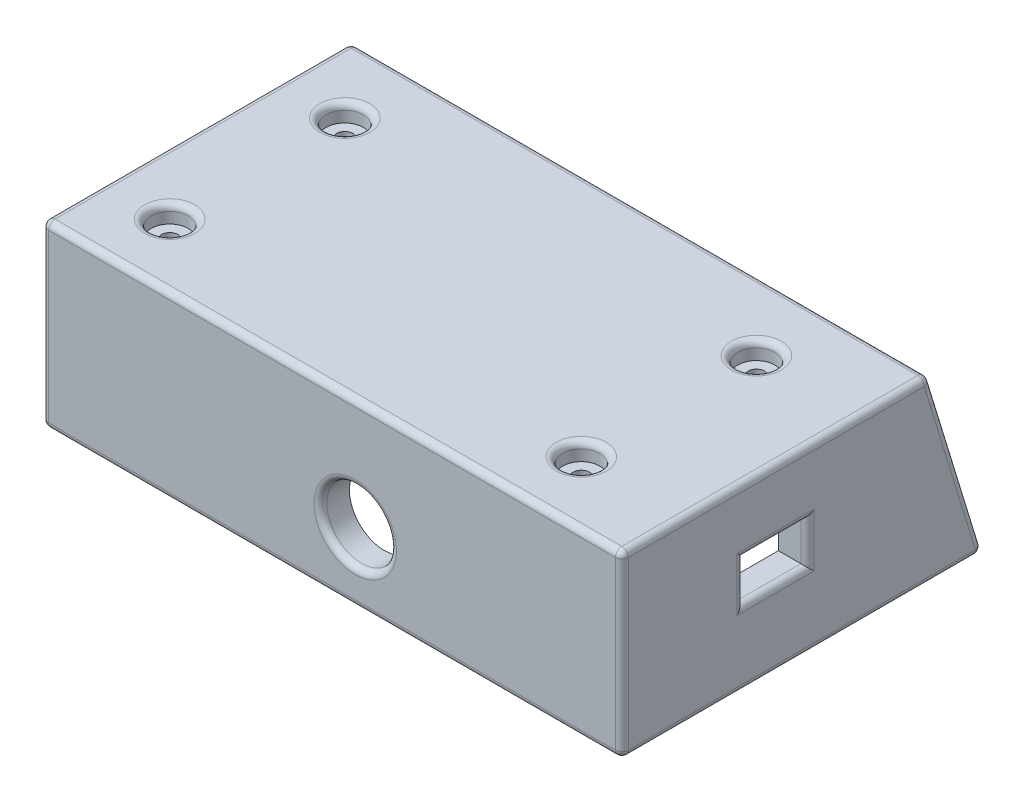
from build123d import *

# Parameters (mm, degrees)
SKETCH_1_W                      = 10
SKETCH_1_H                      = 5.3
EXTRUDE_1_DEPTH                 = 2.8
CUT_EXTRUDE_1_DEPTH             = 2.5
SKETCH_4_R                      = 0.13999999999999993
SKETCH_4_R_2                    = 0.13999999999999987
CUT_EXTRUDE_2_DEPTH             = 0.3
CUT_EXTRUDE_3_REACH             = 13.659
CUT_EXTRUDE_4_REACH             = 13.659
SKETCH_7_W                      = 3
SKETCH_7_H                      = 0.5
CUT_EXTRUDE_4_DIRECTION_2_DEPTH = 10
SKETCH_8_W                      = 10
SKETCH_8_H                      = 5.3
SKETCH_8_R                      = 0.3200000000000004
SKETCH_8_R_2                    = 0.3200000000000005
SKETCH_8_R_3                    = 0.32
EXTRUDE_4_DEPTH                 = 0.3
EXTRUDE_5_DEPTH                 = 10
CUT_EXTRUDE_5_REACH             = 13.517
SKETCH_10_W                     = 3.000000000000001
SKETCH_10_H                     = 0.5000000000000002
CUT_EXTRUDE_6_REACH             = 14.193
SKETCH_11_R                     = 0.6000000000000002
SCALE_1_SCALE                   = 10
FILLET_1_R                      = 1.11
FILLET_2_R                      = 1.11
FILLET_3_R                      = 1.11
FILLET_4_R                      = 1.11
FILLET_5_R                      = 1.11


with BuildPart() as part:
    # 草圖1 → 填料-伸長1 (new body)
    with BuildSketch(Plane(origin=(0, 0, 0), x_dir=(1, 0, 0), z_dir=(0, 1, 0))):
        with Locations((5, 2.65)):
            Rectangle(SKETCH_1_W, SKETCH_1_H)
    extrude(amount=EXTRUDE_1_DEPTH)

    # 草圖3 → 除料-伸長1 (cut)
    with BuildSketch(Plane.XZ):
        Polygon((9.5, -4.799999999999999), (0.5000000000000004, -4.8), (0.5000000000000004, -0.5000000000000011), (9.5, -0.5), align=None)
    extrude(amount=-CUT_EXTRUDE_1_DEPTH, mode=Mode.SUBTRACT)

    # 草圖4 → 除料-伸長2 (cut)
    with BuildSketch(Plane(origin=(0, 2.8, 0), x_dir=(1, 0, 0), z_dir=(0, 1, 0))):
        with Locations(Location((1.1, 1.1, 0), (0, 0, 270))):
            Circle(SKETCH_4_R)
        with Locations(Location((1.1, 4.12, 0), (0, 0, 270))):
            Circle(SKETCH_4_R)
        with Locations(Location((8.2, 1.1, 0), (0, 0, 270))):
            Circle(SKETCH_4_R_2)
        with Locations(Location((8.2, 4.12, 0), (0, 0, 270))):
            Circle(SKETCH_4_R)
    extrude(amount=-CUT_EXTRUDE_2_DEPTH, mode=Mode.SUBTRACT)

    # 草圖5 → 除料-伸長3 (cut, up to next)
    with BuildSketch(Plane(origin=(10, 0, 0), x_dir=(0, 0, -1), z_dir=(1, 0, 0)), mode=Mode.PRIVATE) as cut_extrude_3_sk1:
        Polygon((3.199968847141929, 1.9968818566740154), (2.100259628985645, 1.9968818566740154), (2.100259628985645, 1.296236122516535), (3.199968847141929, 1.2962361225165353), align=None)
    cut_extrude_3_tool1 = extrude(cut_extrude_3_sk1.sketch, amount=-CUT_EXTRUDE_3_REACH, mode=Mode.PRIVATE) & part.part
    add(cut_extrude_3_tool1.solids().sort_by_distance((10, 1.646559, -2.650114))[0], mode=Mode.SUBTRACT)

    # 草圖7 → 除料-伸長4 (cut, up to next)
    with BuildSketch(Plane(origin=(0, 0, -5.3), x_dir=(-1, 0, 0), z_dir=(0, 0, -1)), mode=Mode.PRIVATE) as cut_extrude_4_sk1:
        with Locations((-6.5, 0.55)):
            Rectangle(SKETCH_7_W, SKETCH_7_H)
    cut_extrude_4_tool1 = extrude(cut_extrude_4_sk1.sketch, amount=-CUT_EXTRUDE_4_REACH, mode=Mode.PRIVATE) & part.part
    add(cut_extrude_4_tool1.solids().sort_by_distance((6.5, 0.55, -5.3))[0], mode=Mode.SUBTRACT)

    # 草圖7 → 除料-伸長4 direction 2 (cut)
    with BuildSketch(Plane(origin=(0, 0, -5.3), x_dir=(-1, 0, 0), z_dir=(0, 0, -1))):
        with Locations((-6.5, 0.55)):
            Rectangle(SKETCH_7_W, SKETCH_7_H)
    extrude(amount=CUT_EXTRUDE_4_DIRECTION_2_DEPTH, mode=Mode.SUBTRACT)

    # 草圖8 → 填料-伸長4 (add)
    with BuildSketch(Plane(origin=(0, 2.8, 0), x_dir=(1, 0, 0), z_dir=(0, 1, 0))):
        with Locations((5, 2.65)):
            Rectangle(SKETCH_8_W, SKETCH_8_H)
        with Locations(Location((8.2, 1.1, 0), (0, 0, 270))):
            Circle(SKETCH_8_R, mode=Mode.SUBTRACT)
        with Locations(Location((8.2, 4.12, 0), (0, 0, 270))):
            Circle(SKETCH_8_R_2, mode=Mode.SUBTRACT)
        with Locations(Location((1.1000000000000003, 4.12, 0), (0, 0, 270))):
            Circle(SKETCH_8_R_3, mode=Mode.SUBTRACT)
        with Locations(Location((1.1000000000000003, 1.1, 0), (0, 0, 270))):
            Circle(SKETCH_8_R, mode=Mode.SUBTRACT)
    extrude(amount=EXTRUDE_4_DEPTH)

    # 草圖9 → 填料-伸長5 (add)
    with BuildSketch(Plane.ZY):
        Polygon((-5.3, 0), (-6.248856782761436, 0), (-5.3, 3.1), align=None)
    extrude(amount=-EXTRUDE_5_DEPTH)

    # 草圖10 → 除料-伸長5 (cut, up to next)
    with BuildSketch(Plane.XY.offset(-4.8), mode=Mode.PRIVATE) as cut_extrude_5_sk1:
        with Locations((6.5, 0.5500000000000002)):
            Rectangle(SKETCH_10_W, SKETCH_10_H)
    cut_extrude_5_tool1 = extrude(cut_extrude_5_sk1.sketch, amount=-CUT_EXTRUDE_5_REACH, mode=Mode.PRIVATE) & part.part
    add(cut_extrude_5_tool1.solids().sort_by_distance((6.5, 0.55, -4.8))[0], mode=Mode.SUBTRACT)

    # 草圖11 → 除料-伸長6 (cut, up to next)
    with BuildSketch(Plane.XY, mode=Mode.PRIVATE) as cut_extrude_6_sk1:
        with Locations((5.4, 1.2)):
            Circle(SKETCH_11_R)
    cut_extrude_6_tool1 = extrude(cut_extrude_6_sk1.sketch, amount=-CUT_EXTRUDE_6_REACH, mode=Mode.PRIVATE) & part.part
    add(cut_extrude_6_tool1.solids().sort_by_distance((5.4, 1.2, 0))[0], mode=Mode.SUBTRACT)


with BuildPart() as part_1:
    # 縮放比例1: scaled about (4.939483412, 1.840089484, -3.152251455)
    add(part.part.scale(SCALE_1_SCALE).moved(Location((-44.455350708000005, -16.560805356, 28.370263095))))

    # 圓角1
    fillet_1_edges = [part_1.edges().sort_by_distance(p)[0] for p in [
        (-44.455350708000005, -1.0608053559999977, -29.374020818807182),
        (-44.455350708000005, -16.560805356, -2.874020818807182),
        (-44.455350708000005, 14.439194644, 1.8702630949999985),
        (-44.455350708000005, -1.0608053560000013, 28.370263095),
    ]]
    fillet(fillet_1_edges, radius=FILLET_1_R)

    # 圓角2
    fillet_2_edges = [part_1.edges().sort_by_distance(p)[0] for p in [
        (55.544649291999995, -1.0608053559999977, -29.374020818807182),
        (55.544649291999995, -0.09521546004724613, -3.6294253764192916),
        (55.544649291999995, 3.4080132107401546, 1.8691207143621291),
        (55.544649291999995, -0.09521546004724613, 7.367666805143546),
        (55.544649291999995, -3.598444130834647, 1.8691207143621256),
        (55.544649291999995, -16.560805356, -2.874020818807182),
        (55.544649291999995, -1.0608053560000013, 28.370263095),
        (55.544649291999995, 14.439194644, 1.8702630949999985),
    ]]
    fillet(fillet_2_edges, radius=FILLET_2_R)

    # 圓角3
    # the kernel refuses this fillet: 1.11 mm, written as the material it takes off along each edge
    with BuildSketch(Plane(origin=(-43.345350708000005, 13.329194644000001, 27.260263095), x_dir=(0, 1, 0), z_dir=(0, 0, 1))) as fillet_3_piece_1_section:
        Polygon((0, 0), (FILLET_3_R, 0), (FILLET_3_R, FILLET_3_R), (0, FILLET_3_R), align=None)
    fillet_3_piece_1 = extrude(amount=FILLET_3_R, mode=Mode.PRIVATE)
    fillet_3_piece_1 = fillet_3_piece_1 - Plane(origin=(-43.345350708000005, 13.329194644000001, 27.260263095), x_dir=(0.7071067811865475, -0.7071067811865475, 0), z_dir=(0, 0, 1)) * Sphere(FILLET_3_R, mode=Mode.PRIVATE)
    add(fillet_3_piece_1, mode=Mode.SUBTRACT)
    with BuildSketch(Plane(origin=(-43.345350708000005, -15.450805356, 27.260263095), x_dir=(0, -1, 0), z_dir=(0, 0, 1))) as fillet_3_piece_2_section:
        Polygon((0, 0), (FILLET_3_R, 0), (FILLET_3_R, -FILLET_3_R), (0, -FILLET_3_R), align=None)
    fillet_3_piece_2 = extrude(amount=FILLET_3_R, mode=Mode.PRIVATE)
    fillet_3_piece_2 = fillet_3_piece_2 - Plane(origin=(-43.345350708000005, -15.450805356, 27.260263095), x_dir=(0.7071067811865475, 0.7071067811865475, 0), z_dir=(0, 0, 1)) * Sphere(FILLET_3_R, mode=Mode.PRIVATE)
    add(fillet_3_piece_2, mode=Mode.SUBTRACT)
    with BuildSketch(Plane(origin=(54.434649291999996, 13.329194644000001, 27.260263095), x_dir=(0, 1, 0), z_dir=(0, 0, 1))) as fillet_3_piece_3_section:
        Polygon((0, 0), (FILLET_3_R, 0), (FILLET_3_R, -FILLET_3_R), (0, -FILLET_3_R), align=None)
    fillet_3_piece_3 = extrude(amount=FILLET_3_R, mode=Mode.PRIVATE)
    fillet_3_piece_3 = fillet_3_piece_3 - Plane(origin=(54.434649291999996, 13.329194644000001, 27.260263095), x_dir=(-0.7071067811865475, -0.7071067811865475, 0), z_dir=(0, 0, 1)) * Sphere(FILLET_3_R, mode=Mode.PRIVATE)
    add(fillet_3_piece_3, mode=Mode.SUBTRACT)
    with BuildSketch(Plane(origin=(54.434649291999996, -15.450805356, 27.260263095), x_dir=(0, -1, 0), z_dir=(0, 0, 1))) as fillet_3_piece_4_section:
        Polygon((0, 0), (FILLET_3_R, 0), (FILLET_3_R, FILLET_3_R), (0, FILLET_3_R), align=None)
    fillet_3_piece_4 = extrude(amount=FILLET_3_R, mode=Mode.PRIVATE)
    fillet_3_piece_4 = fillet_3_piece_4 - Plane(origin=(54.434649291999996, -15.450805356, 27.260263095), x_dir=(-0.7071067811865475, 0.7071067811865475, 0), z_dir=(0, 0, 1)) * Sphere(FILLET_3_R, mode=Mode.PRIVATE)
    add(fillet_3_piece_4, mode=Mode.SUBTRACT)
    with BuildSketch(Plane(origin=(9.544649291999995, -4.5608053559999995, 28.370263095), x_dir=(1, 0, 0), z_dir=(0, -1, 0))) as fillet_3_piece_5:
        with BuildLine():
            CenterArc((6 + FILLET_3_R, -FILLET_3_R), FILLET_3_R, 90, 90)
            Line((6, -FILLET_3_R), (6, 0))
            Line((6, 0), (6 + FILLET_3_R, 0))
        make_face()
    revolve(axis=Axis((9.544649291999995, -4.5608053559999995, 28.370263095), (0, 0, 1)), mode=Mode.SUBTRACT)
    with BuildSketch(Plane(origin=(54.434649291999996, 14.439194644, 28.370263095), x_dir=(0, -1, 0), z_dir=(-1, 0, 0)), Plane(origin=(-43.345350708000005, -16.560805356, 28.370263095), x_dir=(0, 1, 0), z_dir=(1, 0, 0))) as fillet_3_piece_6:
        with BuildLine():
            CenterArc((FILLET_3_R, -FILLET_3_R), FILLET_3_R, 90, 90)
            Line((0, -FILLET_3_R), (0, 0))
            Line((0, 0), (FILLET_3_R, 0))
        make_face()
    extrude(amount=97.78, mode=Mode.SUBTRACT)

    # 圓角4
    # the kernel refuses this fillet: 1.11 mm, written as the material it takes off along each edge
    with BuildSketch(Plane(origin=(-43.345350708000005, 13.329194644000001, -23.80865665520716), x_dir=(0, 1, 0), z_dir=(-1, 0, 0))) as fillet_4_piece_1_section:
        Polygon((0, 0), (FILLET_4_R, 0), (FILLET_4_R, FILLET_4_R * 0.73971193675), (FILLET_4_R * 0.292679636539, FILLET_4_R * 0.956210557542), align=None)
    fillet_4_piece_1 = extrude(amount=FILLET_4_R, mode=Mode.PRIVATE)
    fillet_4_piece_1 = fillet_4_piece_1 - Plane(origin=(-43.345350708000005, 13.329194644000001, -23.80865665520716), x_dir=(0, -0.8039526219060927, 0.5946933510056414), z_dir=(-1, 0, 0)) * Sphere(FILLET_4_R, mode=Mode.PRIVATE)
    add(fillet_4_piece_1, mode=Mode.SUBTRACT)
    with BuildSketch(Plane(origin=(54.434649291999996, 13.329194644000001, -23.80865665520716), x_dir=(0, 1, 0), z_dir=(1, 0, 0))) as fillet_4_piece_2_section:
        Polygon((0, 0), (FILLET_4_R, 0), (FILLET_4_R, -FILLET_4_R * 0.73971193675), (FILLET_4_R * 0.292679636539, -FILLET_4_R * 0.956210557542), align=None)
    fillet_4_piece_2 = extrude(amount=FILLET_4_R, mode=Mode.PRIVATE)
    fillet_4_piece_2 = fillet_4_piece_2 - Plane(origin=(54.434649291999996, 13.329194644000001, -23.80865665520716), x_dir=(0, -0.8039526219060927, 0.5946933510056414), z_dir=(1, 0, 0)) * Sphere(FILLET_4_R, mode=Mode.PRIVATE)
    add(fillet_4_piece_2, mode=Mode.SUBTRACT)
    with BuildSketch(Plane(origin=(-43.345350708000005, 14.439194644, -24.629736905), x_dir=(0, 0, 1), z_dir=(1, 0, 0))) as fillet_4_piece_3:
        with BuildLine():
            CenterArc((FILLET_4_R * 0.73971193675, FILLET_4_R), FILLET_4_R, 197.01845025050858, 72.98154974949142)
            Line((-FILLET_4_R * 0.216498620792, FILLET_4_R * 0.707320363461), (0, 0))
            Line((0, 0), (FILLET_4_R * 0.73971193675, 0))
        make_face()
    extrude(amount=97.78, mode=Mode.SUBTRACT)
    with BuildSketch(Plane(origin=(37.544649291999995, 14.439194644, 17.370263095), x_dir=(0, 0, 1), z_dir=(-1, 0, 0))) as fillet_4_piece_4:
        with BuildLine():
            CenterArc((3.200000000000003 + FILLET_4_R, -FILLET_4_R), FILLET_4_R, 90, 90)
            Line((3.200000000000003, -FILLET_4_R), (3.200000000000003, 0))
            Line((3.200000000000003, 0), (3.200000000000003 + FILLET_4_R, 0))
        make_face()
    revolve(axis=Axis((37.544649291999995, 14.439194644, 17.370263095), (0, 1, 0)), mode=Mode.SUBTRACT)
    with BuildSketch(Plane(origin=(37.544649291999995, 14.439194644, -12.829736905000004), x_dir=(0, 0, 1), z_dir=(-1, 0, 0))) as fillet_4_piece_5:
        with BuildLine():
            CenterArc((3.200000000000003 + FILLET_4_R, -FILLET_4_R), FILLET_4_R, 90, 90)
            Line((3.200000000000003, -FILLET_4_R), (3.200000000000003, 0))
            Line((3.200000000000003, 0), (3.200000000000003 + FILLET_4_R, 0))
        make_face()
    revolve(axis=Axis((37.544649291999995, 14.439194644, -12.829736905000004), (0, 1, 0)), mode=Mode.SUBTRACT)
    with BuildSketch(Plane(origin=(-33.455350708, 14.439194644, -12.829736905000004), x_dir=(0, 0, 1), z_dir=(-1, 0, 0))) as fillet_4_piece_6:
        with BuildLine():
            CenterArc((3.200000000000003 + FILLET_4_R, -FILLET_4_R), FILLET_4_R, 90, 90)
            Line((3.200000000000003, -FILLET_4_R), (3.200000000000003, 0))
            Line((3.200000000000003, 0), (3.200000000000003 + FILLET_4_R, 0))
        make_face()
    revolve(axis=Axis((-33.455350708, 14.439194644, -12.829736905000004), (0, 1, 0)), mode=Mode.SUBTRACT)
    with BuildSketch(Plane(origin=(-33.455350708, 14.439194644, 17.370263095), x_dir=(0, 0, 1), z_dir=(-1, 0, 0))) as fillet_4_piece_7:
        with BuildLine():
            CenterArc((3.200000000000003 + FILLET_4_R, -FILLET_4_R), FILLET_4_R, 90, 90)
            Line((3.200000000000003, -FILLET_4_R), (3.200000000000003, 0))
            Line((3.200000000000003, 0), (3.200000000000003 + FILLET_4_R, 0))
        make_face()
    revolve(axis=Axis((-33.455350708, 14.439194644, 17.370263095), (0, 1, 0)), mode=Mode.SUBTRACT)

    # 圓角5
    # the kernel refuses this fillet: 1.11 mm, written as the material it takes off along each edge
    with BuildSketch(Plane(origin=(-43.345350708000005, -15.450805356, -32.61772059323107), x_dir=(0, -1, 0), z_dir=(-1, 0, 0))) as fillet_5_piece_1_section:
        Polygon((0, 0), (FILLET_5_R, 0), (FILLET_5_R, -FILLET_5_R * 1.35187760305), (-FILLET_5_R * 0.292679636539, -FILLET_5_R * 0.956210557542), align=None)
    fillet_5_piece_1 = extrude(amount=FILLET_5_R, mode=Mode.PRIVATE)
    fillet_5_piece_1 = fillet_5_piece_1 - Plane(origin=(-43.345350708000005, -15.450805356, -32.61772059323107), x_dir=(0, 0.5946933510056415, 0.8039526219060928), z_dir=(-1, 0, 0)) * Sphere(FILLET_5_R, mode=Mode.PRIVATE)
    add(fillet_5_piece_1, mode=Mode.SUBTRACT)
    with BuildSketch(Plane(origin=(54.434649291999996, -15.450805356, -32.61772059323107), x_dir=(0, -1, 0), z_dir=(1, 0, 0))) as fillet_5_piece_2_section:
        Polygon((0, 0), (FILLET_5_R, 0), (FILLET_5_R, FILLET_5_R * 1.35187760305), (-FILLET_5_R * 0.292679636539, FILLET_5_R * 0.956210557542), align=None)
    fillet_5_piece_2 = extrude(amount=FILLET_5_R, mode=Mode.PRIVATE)
    fillet_5_piece_2 = fillet_5_piece_2 - Plane(origin=(54.434649291999996, -15.450805356, -32.61772059323107), x_dir=(0, 0.5946933510056415, 0.8039526219060928), z_dir=(1, 0, 0)) * Sphere(FILLET_5_R, mode=Mode.PRIVATE)
    add(fillet_5_piece_2, mode=Mode.SUBTRACT)
    with BuildSketch(Plane(origin=(5.5446492919999955, -5.907321058820363, -30.85745607602683), x_dir=(-1, 0, 0), z_dir=(0, -0.9562105575422115, -0.29267963653936196))) as fillet_5_piece_3_section:
        with BuildLine():
            CenterArc((FILLET_5_R, -FILLET_5_R), FILLET_5_R, 90, 90)
            Line((-8.9e-16, -FILLET_5_R), (0, 0))
            Line((0, 0), (FILLET_5_R, 0))
        make_face()
    fillet_5_piece_3 = extrude(amount=10.778973849495777, mode=Mode.PRIVATE)
    fillet_5_piece_3 = split(fillet_5_piece_3, bisect_by=Plane(origin=(5.29335071516381, -8.560805355999998, -32.17204241302191), z_dir=(0, -1, 0)), keep=Keep.TOP, mode=Mode.PRIVATE)
    fillet_5_piece_3 = split(fillet_5_piece_3, bisect_by=Plane(origin=(5.293350715163811, -13.560805356, -32.17204241302191), z_dir=(0, 1, 0)), keep=Keep.TOP, mode=Mode.PRIVATE)
    add(fillet_5_piece_3, mode=Mode.SUBTRACT)
    with BuildSketch(Plane(origin=(35.544649291999995, -8.560805355999998, -31.669642067423553), x_dir=(0, 0.9562105575422125, 0.29267963653935886), z_dir=(-1, 0, 0))) as fillet_5_piece_4:
        with BuildLine():
            CenterArc((FILLET_5_R * 1.35187760305, -FILLET_5_R), FILLET_5_R, 89.99999999999982, 107.01845025050886)
            Line((FILLET_5_R * 0.395667045506, -FILLET_5_R * 1.29267963654), (0, 0))
            Line((0, 0), (FILLET_5_R * 1.35187760305, -2e-17))
        make_face()
    extrude(amount=30, mode=Mode.SUBTRACT)
    with BuildSketch(Plane(origin=(35.544649291999995, -16.214289653179637, -34.01224222456454), x_dir=(1, 0, 0), z_dir=(0, 0.9562105575422115, 0.29267963653936196))) as fillet_5_piece_5_section:
        with BuildLine():
            CenterArc((FILLET_5_R, -FILLET_5_R), FILLET_5_R, 90, 90)
            Line((0, -FILLET_5_R), (0, 0))
            Line((0, 0), (FILLET_5_R, 0))
        make_face()
    fillet_5_piece_5 = extrude(amount=10.778973849495781, mode=Mode.PRIVATE)
    fillet_5_piece_5 = split(fillet_5_piece_5, bisect_by=Plane(origin=(35.79594786883617, -8.560805355999998, -32.1720424130219), z_dir=(0, -1, 0)), keep=Keep.TOP, mode=Mode.PRIVATE)
    fillet_5_piece_5 = split(fillet_5_piece_5, bisect_by=Plane(origin=(35.79594786883617, -13.560805356, -32.1720424130219), z_dir=(0, 1, 0)), keep=Keep.TOP, mode=Mode.PRIVATE)
    add(fillet_5_piece_5, mode=Mode.SUBTRACT)
    with BuildSketch(Plane(origin=(5.544649291999988, -13.560805356, -33.200056233167814), x_dir=(0, -0.9562105575422132, -0.29267963653935636), z_dir=(1, 0, 0))) as fillet_5_piece_6:
        with BuildLine():
            CenterArc((FILLET_5_R * 0.73971193675, -FILLET_5_R), FILLET_5_R, 90.0000000000003, 72.98154974949095)
            Line((-FILLET_5_R * 0.216498620792, -FILLET_5_R * 0.707320363461), (0, 0))
            Line((0, 0), (FILLET_5_R * 0.73971193675, -2e-17))
        make_face()
    extrude(amount=30.000000000000007, mode=Mode.SUBTRACT)
    with BuildSketch(Plane(origin=(-43.345350708000005, -16.560805356, -34.11830473261436), x_dir=(0, 0, 1), z_dir=(1, 0, 0))) as fillet_5_piece_7:
        with BuildLine():
            CenterArc((FILLET_5_R * 1.35187760305, -FILLET_5_R), FILLET_5_R, 90, 107.01845025050858)
            Line((FILLET_5_R * 0.395667045506, -FILLET_5_R * 1.29267963654), (0, 0))
            Line((0, 0), (FILLET_5_R * 1.35187760305, 0))
        make_face()
    extrude(amount=97.78, mode=Mode.SUBTRACT)
    with BuildSketch(Plane(origin=(35.544649291999995, -8.560805355999998, -31.669642067423553), x_dir=(0, 0.9562105575422125, 0.29267963653935886), z_dir=(-1, 0, 0))) as fillet_5_piece_8a_section:
        with BuildLine():
            CenterArc((FILLET_5_R * 1.35187760305, -FILLET_5_R), FILLET_5_R, 89.99999999999982, 107.01845025050886)
            Line((FILLET_5_R * 0.395667045506, -FILLET_5_R * 1.29267963654), (0, 0))
            Line((0, 0), (FILLET_5_R * 1.35187760305, -2e-17))
        make_face()
    fillet_5_piece_8a = extrude(amount=33.75146034845822, mode=Mode.PRIVATE)
    fillet_5_piece_8a = split(fillet_5_piece_8a, bisect_by=Plane(origin=(5.5446492919999955, -8.22260760341926, -31.21244010030849), z_dir=(-1, 0, 0)), keep=Keep.TOP, mode=Mode.PRIVATE)
    with BuildSketch(Plane(origin=(5.5446492919999955, -5.907321058820363, -30.85745607602683), x_dir=(-1, 0, 0), z_dir=(0, -0.9562105575422115, -0.29267963653936196))) as fillet_5_piece_8b_section:
        with BuildLine():
            CenterArc((FILLET_5_R, -FILLET_5_R), FILLET_5_R, 90, 90)
            Line((-8.9e-16, -FILLET_5_R), (0, 0))
            Line((0, 0), (FILLET_5_R, 0))
        make_face()
    fillet_5_piece_8b = extrude(amount=10.778973849495777, mode=Mode.PRIVATE)
    fillet_5_piece_8b = split(fillet_5_piece_8b, bisect_by=Plane(origin=(5.289512950668513, -8.560805355999998, -31.018501317013534), z_dir=(0, 1, 0)), keep=Keep.TOP, mode=Mode.PRIVATE)
    fillet_5_piece_8 = fillet_5_piece_8a & fillet_5_piece_8b
    add(fillet_5_piece_8, mode=Mode.SUBTRACT)
    with BuildSketch(Plane(origin=(5.5446492919999955, -5.907321058820363, -30.85745607602683), x_dir=(-1, 0, 0), z_dir=(0, -0.9562105575422115, -0.29267963653936196))) as fillet_5_piece_9a_section:
        with BuildLine():
            CenterArc((FILLET_5_R, -FILLET_5_R), FILLET_5_R, 90, 90)
            Line((-8.9e-16, -FILLET_5_R), (0, 0))
            Line((0, 0), (FILLET_5_R, 0))
        make_face()
    fillet_5_piece_9a = extrude(amount=10.778973849495777, mode=Mode.PRIVATE)
    fillet_5_piece_9a = split(fillet_5_piece_9a, bisect_by=Plane(origin=(5.29698146540283, -13.560805356, -33.34844666341145), z_dir=(0, -1, 0)), keep=Keep.TOP, mode=Mode.PRIVATE)
    with BuildSketch(Plane(origin=(3.4919486675178817, -13.560805356, -33.200056233167814), x_dir=(0, -0.9562105575422132, -0.29267963653935636), z_dir=(1, 0, 0))) as fillet_5_piece_9b_section:
        with BuildLine():
            CenterArc((FILLET_5_R * 0.73971193675, -FILLET_5_R), FILLET_5_R, 90.0000000000003, 72.98154974949095)
            Line((-FILLET_5_R * 0.216498620792, -FILLET_5_R * 0.707320363461), (0, 0))
            Line((0, 0), (FILLET_5_R * 0.73971193675, -2e-17))
        make_face()
    fillet_5_piece_9b = extrude(amount=32.052700624482114, mode=Mode.PRIVATE)
    fillet_5_piece_9b = split(fillet_5_piece_9b, bisect_by=Plane(origin=(5.5446492919999955, -13.733631636877407, -33.07221457021865), z_dir=(-1, 0, 0)), keep=Keep.TOP, mode=Mode.PRIVATE)
    fillet_5_piece_9 = fillet_5_piece_9a & fillet_5_piece_9b
    add(fillet_5_piece_9, mode=Mode.SUBTRACT)
    with BuildSketch(Plane(origin=(39.29610964045822, -8.560805355999998, -31.66964206742356), x_dir=(0, 0.9562105575422111, 0.2926796365393635), z_dir=(-1, 0, 0))) as fillet_5_piece_10a_section:
        with BuildLine():
            CenterArc((FILLET_5_R * 1.35187760305, -FILLET_5_R), FILLET_5_R, 90.00000000000009, 107.01845025050852)
            Line((FILLET_5_R * 0.395667045506, -FILLET_5_R * 1.29267963654), (0, 0))
            Line((0, 0), (FILLET_5_R * 1.35187760305, -1e-17))
        make_face()
    fillet_5_piece_10a = extrude(amount=33.751460348458224, mode=Mode.PRIVATE)
    fillet_5_piece_10a = split(fillet_5_piece_10a, bisect_by=Plane(origin=(35.544649291999995, -8.222607603419256, -31.212440100308488), z_dir=(1, 0, 0)), keep=Keep.TOP, mode=Mode.PRIVATE)
    with BuildSketch(Plane(origin=(35.544649291999995, -16.214289653179637, -34.01224222456454), x_dir=(1, 0, 0), z_dir=(0, 0.9562105575422115, 0.29267963653936196))) as fillet_5_piece_10b_section:
        with BuildLine():
            CenterArc((FILLET_5_R, -FILLET_5_R), FILLET_5_R, 90, 90)
            Line((0, -FILLET_5_R), (0, 0))
            Line((0, 0), (FILLET_5_R, 0))
        make_face()
    fillet_5_piece_10b = extrude(amount=10.778973849495781, mode=Mode.PRIVATE)
    fillet_5_piece_10b = split(fillet_5_piece_10b, bisect_by=Plane(origin=(35.79978563333149, -8.560805355999998, -31.018501317013552), z_dir=(0, 1, 0)), keep=Keep.TOP, mode=Mode.PRIVATE)
    fillet_5_piece_10 = fillet_5_piece_10a & fillet_5_piece_10b
    add(fillet_5_piece_10, mode=Mode.SUBTRACT)
    with BuildSketch(Plane(origin=(35.544649291999995, -16.214289653179637, -34.01224222456454), x_dir=(1, 0, 0), z_dir=(0, 0.9562105575422115, 0.29267963653936196))) as fillet_5_piece_11a_section:
        with BuildLine():
            CenterArc((FILLET_5_R, -FILLET_5_R), FILLET_5_R, 90, 90)
            Line((0, -FILLET_5_R), (0, 0))
            Line((0, 0), (FILLET_5_R, 0))
        make_face()
    fillet_5_piece_11a = extrude(amount=10.778973849495781, mode=Mode.PRIVATE)
    fillet_5_piece_11a = split(fillet_5_piece_11a, bisect_by=Plane(origin=(35.79231711859715, -13.560805356, -33.34844666341147), z_dir=(0, -1, 0)), keep=Keep.TOP, mode=Mode.PRIVATE)
    with BuildSketch(Plane(origin=(5.544649291999988, -13.560805356, -33.200056233167814), x_dir=(0, -0.9562105575422132, -0.29267963653935636), z_dir=(1, 0, 0))) as fillet_5_piece_11b_section:
        with BuildLine():
            CenterArc((FILLET_5_R * 0.73971193675, -FILLET_5_R), FILLET_5_R, 90.0000000000003, 72.98154974949095)
            Line((-FILLET_5_R * 0.216498620792, -FILLET_5_R * 0.707320363461), (0, 0))
            Line((0, 0), (FILLET_5_R * 0.73971193675, -2e-17))
        make_face()
    fillet_5_piece_11b = extrude(amount=32.05270062448211, mode=Mode.PRIVATE)
    fillet_5_piece_11b = split(fillet_5_piece_11b, bisect_by=Plane(origin=(35.544649291999995, -13.733631636877405, -33.072214570218634), z_dir=(1, 0, 0)), keep=Keep.TOP, mode=Mode.PRIVATE)
    fillet_5_piece_11 = fillet_5_piece_11a & fillet_5_piece_11b
    add(fillet_5_piece_11, mode=Mode.SUBTRACT)


solid = part_1.part
